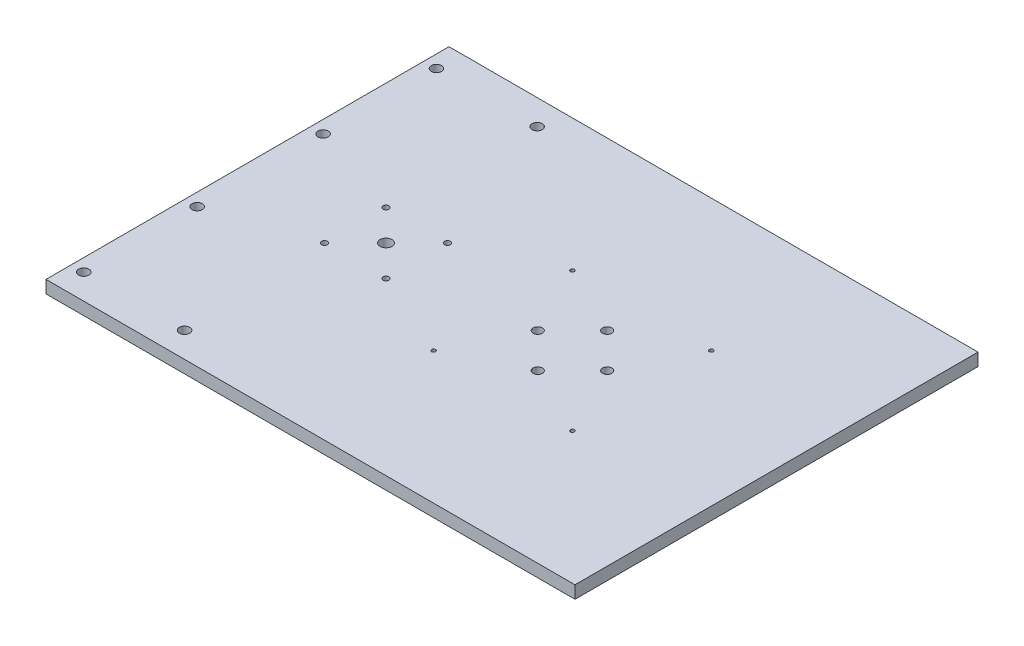
from build123d import *

# Parameters (mm, degrees)
SKETCH1_W           = 266.7
SKETCH1_H           = 203.2
BOSS_EXTRUDE1_DEPTH = 6.35
SKETCH3_R           = 2.600000007
CUT_EXTRUDE1_DEPTH  = 168.765029133
SKETCH5_R           = 1.5
SKETCH5_R_2         = 3.007999953
CUT_EXTRUDE2_DEPTH  = 168.765029133
SKETCH7_R           = 0.999998
CUT_EXTRUDE3_DEPTH  = 168.765029133
SKETCH8_R           = 2.35
CUT_EXTRUDE4_DEPTH  = 168.765029133


with BuildPart() as part:
    # Sketch1 → Boss-Extrude1 (new body)
    with BuildSketch(Plane(origin=(0, 0, 0), x_dir=(1, 0, 0), z_dir=(0, 1, 0))):
        Rectangle(SKETCH1_W, SKETCH1_H)
    extrude(amount=BOSS_EXTRUDE1_DEPTH)

    # Sketch3 → Cut-Extrude1 (cut, through all)
    with BuildSketch(Plane(origin=(0, 6.35, 0), x_dir=(1, 0, 0), z_dir=(0, 1, 0))):
        with Locations((-127, -31.75)):
            Circle(SKETCH3_R)
        with Locations((-76.2, -88.9)):
            Circle(SKETCH3_R)
        with Locations((-127, -88.9)):
            Circle(SKETCH3_R)
    cut_extrude1 = extrude(amount=-CUT_EXTRUDE1_DEPTH, mode=Mode.SUBTRACT)

    # Mirror1: Cut-Extrude1 across plane
    add(cut_extrude1.mirror(Plane.XY), mode=Mode.SUBTRACT)

    # Sketch5 → Cut-Extrude2 (cut, through all)
    with BuildSketch(Plane(origin=(0, 6.35, 0), x_dir=(1, 0, 0), z_dir=(0, 1, 0))):
        with Locations((-48.024, 15.5)):
            Circle(SKETCH5_R)
        with Locations((-48.024, -15.5)):
            Circle(SKETCH5_R)
        with Locations((-79.024, 15.5)):
            Circle(SKETCH5_R)
        with Locations((-79.024, -15.5)):
            Circle(SKETCH5_R)
        with Locations((-63.524, 0)):
            Circle(SKETCH5_R_2)
    extrude(amount=-CUT_EXTRUDE2_DEPTH, mode=Mode.SUBTRACT)

    # Sketch7 → Cut-Extrude3 (cut, through all)
    with BuildSketch(Plane(origin=(0, 6.35, 0), x_dir=(1, 0, 0), z_dir=(0, 1, 0))):
        with Locations((65.481787507, -35.001787507)):
            Circle(SKETCH7_R)
        with Locations((-4.521787507, -35.001787507)):
            Circle(SKETCH7_R)
        with Locations((-4.521787507, 35.001787507)):
            Circle(SKETCH7_R)
        with Locations((65.481787507, 35.001787507)):
            Circle(SKETCH7_R)
    extrude(amount=-CUT_EXTRUDE3_DEPTH, mode=Mode.SUBTRACT)

    # Sketch8 → Cut-Extrude4 (cut, through all)
    with BuildSketch(Plane(origin=(0, 6.35, 0), x_dir=(1, 0, 0), z_dir=(0, 1, 0))):
        with Locations((12.98, 0)):
            Circle(SKETCH8_R)
        with Locations((47.98, 0)):
            Circle(SKETCH8_R)
        with BuildLine():
            ThreePointArc((30.48, -19.85), (32.83, -17.5), (30.48, -15.15))
            ThreePointArc((30.48, -15.15), (28.13, -17.5), (30.48, -19.85))
        make_face()
        with BuildLine():
            ThreePointArc((30.48, 15.15), (32.83, 17.5), (30.48, 19.85))
            ThreePointArc((30.48, 19.85), (28.13, 17.5), (30.48, 15.15))
        make_face()
    extrude(amount=-CUT_EXTRUDE4_DEPTH, mode=Mode.SUBTRACT)


solid = part.part
